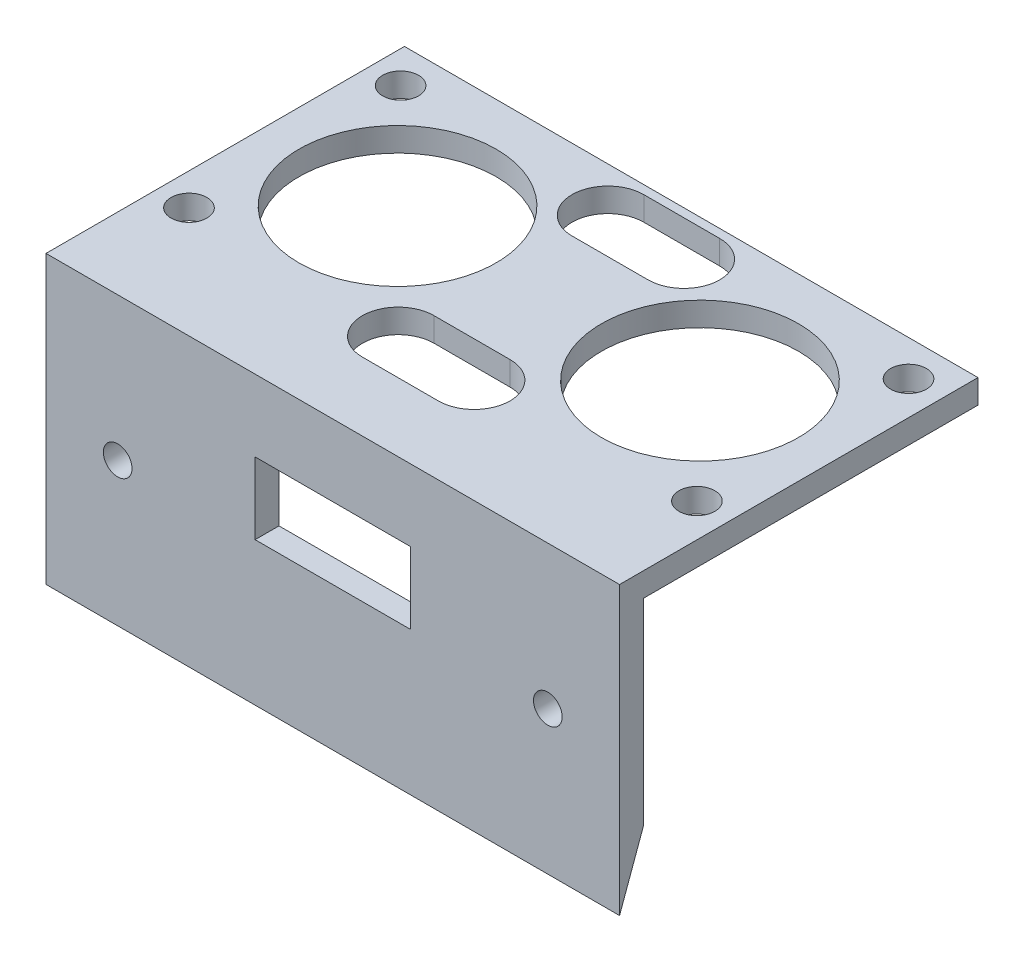
from build123d import *

# Parameters (mm, degrees)
SKIZZE1_W                            = 48
SKIZZE1_H                            = 25
SKIZZE1_R                            = 8.25
SKIZZE1_R_2                          = 1.5
AUFSATZ_LINEAR_AUSTRAGEN1_DEPTH      = 2
SKIZZE2_W                            = 48
SKIZZE2_H                            = 5
AUFSATZ_LINEAR_AUSTRAGEN2_DEPTH      = 2
SKIZZE3_W                            = 48
SKIZZE3_H                            = 22
AUFSATZ_LINEAR_AUSTRAGEN3_DEPTH      = 2
AUFSATZ_LINEAR_AUSTRAGEN4_DEPTH      = 1.5
SCHNITT_LINEAR_AUSTRAGEN1_DEPTH      = 56.702642494
SCHNITT_LINEAR_AUSTRAGEN1_DEPTH_BACK = 56.702642494
SKIZZE6_W                            = 13
SKIZZE6_H                            = 6
SCHNITT_LINEAR_AUSTRAGEN2_DEPTH      = 56.702642494
SCHNITT_LINEAR_AUSTRAGEN2_DEPTH_BACK = 56.702642494
SKIZZE7_R                            = 1.2
FASE1_SIZE                           = 5.5
FASE1_SIZE_2                         = 2.001836288


with BuildPart() as part:
    # Skizze1 → Aufsatz-Linear austragen1 (new body)
    with BuildSketch(Plane(origin=(0, 23.26672716, 0), x_dir=(1, 0, 0), z_dir=(0, 1, 0))):
        with Locations((18.159741318, -23.319374593)):
            Rectangle(SKIZZE1_W, SKIZZE1_H)
        with Locations(Location((5.436155106, -22.674374593, 0), (0, 0, 90))):
            Circle(SKIZZE1_R, mode=Mode.SUBTRACT)
        with Locations(Location((30.746155106, -22.674374593, 0), (0, 0, 90))):
            Circle(SKIZZE1_R, mode=Mode.SUBTRACT)
        with Locations(Location((39.346155106, -31.529374593, 0), (0, 0, 90))):
            Circle(SKIZZE1_R_2, mode=Mode.SUBTRACT)
        with Locations(Location((39.346155106, -13.819374593, 0), (0, 0, 90))):
            Circle(SKIZZE1_R_2, mode=Mode.SUBTRACT)
        with Locations(Location((-3.163844894, -13.819374593, 0), (0, 0, 90))):
            Circle(SKIZZE1_R_2, mode=Mode.SUBTRACT)
        with Locations(Location((-3.163844894, -31.529374593, 0), (0, 0, 90))):
            Circle(SKIZZE1_R_2, mode=Mode.SUBTRACT)
        with BuildLine():
            Line((21.271155106, -29.094374598), (14.911155106, -29.094374598))
            ThreePointArc((14.911155106, -29.094374598), (11.911155106, -32.094374598), (14.911155106, -35.094374598))
            Line((14.911155106, -35.094374598), (21.271155106, -35.094374598))
            ThreePointArc((21.271155106, -35.094374598), (24.271155106, -32.094374598), (21.271155106, -29.094374598))
        make_face(mode=Mode.SUBTRACT)
        with BuildLine():
            Line((14.911155106, -11.544374589), (21.271155106, -11.544374589))
            ThreePointArc((21.271155106, -11.544374589), (24.271155106, -14.544374589), (21.271155106, -17.544374589))
            Line((21.271155106, -17.544374589), (14.911155106, -17.544374589))
            ThreePointArc((14.911155106, -17.544374589), (11.911155106, -14.544374589), (14.911155106, -11.544374589))
        make_face(mode=Mode.SUBTRACT)
    extrude(amount=-AUFSATZ_LINEAR_AUSTRAGEN1_DEPTH)

    # Skizze2 → Aufsatz-Linear austragen2 (add)
    with BuildSketch(Plane(origin=(0, 21.26672716, 0), x_dir=(-1, 0, 0), z_dir=(0, -1, 0))):
        with Locations((-18.159741318, -38.319374593)):
            Rectangle(SKIZZE2_W, SKIZZE2_H)
    extrude(amount=-AUFSATZ_LINEAR_AUSTRAGEN2_DEPTH)

    # Skizze3 → Aufsatz-Linear austragen3 (add)
    with BuildSketch(Plane.XY.offset(40.819374593)):
        with Locations((18.159741318, 10.26672716)):
            Rectangle(SKIZZE3_W, SKIZZE3_H)
    extrude(amount=-AUFSATZ_LINEAR_AUSTRAGEN3_DEPTH)

    # Skizze5 → Aufsatz-Linear austragen4 (add, symmetric)
    with BuildSketch(Plane(origin=(32.159741318, 0, 0), x_dir=(0, 0, -1), z_dir=(1, 0, 0))):
        Polygon((-38.819374593, 17.26672716), (-38.819374593, 21.26672716), (-34.819374593, 21.26672716), align=None)
    aufsatz_linear_austragen4 = extrude(amount=AUFSATZ_LINEAR_AUSTRAGEN4_DEPTH, both=True)

    # Spiegeln1: Aufsatz-Linear austragen4 across plane
    add(aufsatz_linear_austragen4.mirror(Plane(origin=(18.159741318, 0, 0), x_dir=(0, 0, 1), z_dir=(1, 0, 0))))

    # Skizze6 → Schnitt-Linear austragen1 (cut, two sides: drawn at the far end of the back side and taken through both)
    with BuildSketch(Plane(origin=(0, 0, 38.819374593), x_dir=(-1, 0, 0), z_dir=(0, 0, -1)).offset(-SCHNITT_LINEAR_AUSTRAGEN1_DEPTH_BACK)):
        with Locations((-18.159741318, 14.26672716)):
            Rectangle(SKIZZE6_W, SKIZZE6_H)
    extrude(amount=SCHNITT_LINEAR_AUSTRAGEN1_DEPTH + SCHNITT_LINEAR_AUSTRAGEN1_DEPTH_BACK, mode=Mode.SUBTRACT)

    # Skizze7 → Schnitt-Linear austragen2 (cut, two sides: drawn at the far end of the back side and taken through both)
    with BuildSketch(Plane(origin=(0, 0, 38.819374593), x_dir=(-1, 0, 0), z_dir=(0, 0, -1)).offset(-SCHNITT_LINEAR_AUSTRAGEN2_DEPTH_BACK)):
        with Locations((-36.159741318, 11.26672716)):
            Circle(SKIZZE7_R)
        with Locations(Location((-0.159741318, 11.26672716, 0), (0, 0, 180))):
            Circle(SKIZZE7_R)
    extrude(amount=SCHNITT_LINEAR_AUSTRAGEN2_DEPTH + SCHNITT_LINEAR_AUSTRAGEN2_DEPTH_BACK, mode=Mode.SUBTRACT)

    # Fase1
    # the kernel refuses this chamfer: 5.5, 2.001836288 mm, written as the material it takes off along each edge
    with BuildSketch(Plane(origin=(-20.108329711, -0.73327284, 38.819374593), x_dir=(0, 0.9999130865277315, -0.013184058198645307), z_dir=(1, 0, 0))) as fase1_piece_1:
        Polygon((FASE1_SIZE * 0.999913086528, FASE1_SIZE * 0.0131840581986), (-FASE1_SIZE_2 * 0.0131840582017, FASE1_SIZE_2 * 0.99991308676), (0, 0), align=None)
    extrude(amount=76.536142058, mode=Mode.SUBTRACT)


solid = part.part
